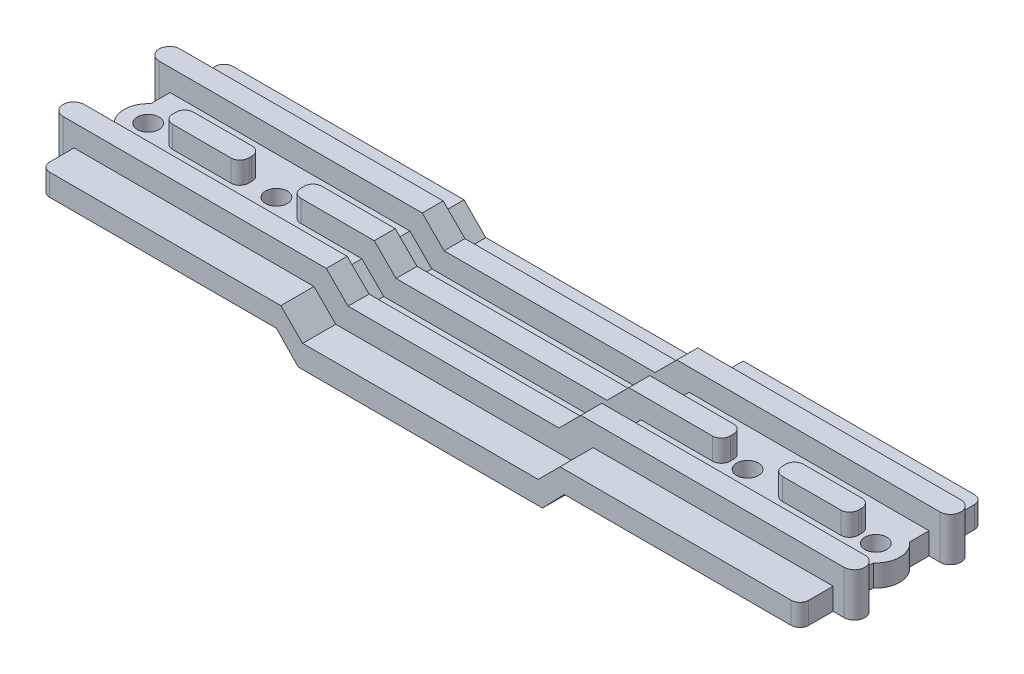
from build123d import *

# Parameters (mm, degrees)
BOSS_EXTRUDE1_DEPTH  = 10.5
SKETCH2_R            = 1.25
CUT_EXTRUDE1_DEPTH   = 46.038983115
BOSS_EXTRUDE19_DEPTH = 1.2
LPATTERN1_START      = -6.7
LPATTERN1_DEPTH      = 2.4
LPATTERN1_START_2    = 4.3
LPATTERN1_2_DEPTH    = 2.4
SKETCH5_R            = 3
CUT_EXTRUDE2_DEPTH   = 2.5
FILLET1_R            = 1
BOSS_EXTRUDE20_DEPTH = 5
FILLET2_R            = 1
BOSS_EXTRUDE21_DEPTH = 2.5


# Read off the part's stored shape, not the designer's step: LPattern1
with BuildPart() as part:
    # Sketch1 → Boss-Extrude1 (new, symmetric)
    with BuildSketch(Plane.XY):
        Polygon((-43.5, 2.6), (-16.5, 2.6), (-14, 0), (14, 0), (16.5, 2.6), (43.5, 2.6), (43.5, 5.1), (16, 5.1), (13.5, 2.6), (-13.5, 2.6), (-16, 5.1), (-43.5, 5.1), align=None)
    extrude(amount=BOSS_EXTRUDE1_DEPTH, both=True)

    # Sketch2 → Cut-Extrude1 (cut, through all)
    with BuildSketch(Plane(origin=(0, 5.1, 0), x_dir=(1, 0, 0), z_dir=(0, 1, 0))):
        with Locations(Location((27, 0, 0), (0, 0, 180))):
            Circle(SKETCH2_R)
        with Locations(Location((41.7, 0, 0), (0, 0, 180))):
            Circle(SKETCH2_R)
    cut_extrude1 = extrude(amount=-CUT_EXTRUDE1_DEPTH, mode=Mode.SUBTRACT)

    # Mirror1: Cut-Extrude1 across plane
    add(cut_extrude1.mirror(Plane(origin=(0, 0, 0), x_dir=(0, 0, 1), z_dir=(1, 0, 0))), mode=Mode.SUBTRACT)

    # Sketch4 → Boss-Extrude19 (add, symmetric)
    with BuildSketch(Plane.XY):
        Polygon((-43.5, 7.6), (-14.587766262, 7.6), (-12.087766262, 5.1), (12.087766262, 5.1), (14.587766262, 7.6), (43.5, 7.6), (43.5, 5.1), (16, 5.1), (13.5, 2.6), (-13.5, 2.6), (-16, 5.1), (-43.5, 5.1), align=None)
    boss_extrude19 = extrude(amount=BOSS_EXTRUDE19_DEPTH, both=True)

    # Mirror2: Boss-Extrude19 across plane
    add(boss_extrude19.mirror(Plane.XY))

    # LPattern1 outline → LPattern1 (add)
    with BuildSketch(Plane.XY.offset(LPATTERN1_START)):
        Polygon((14.587766262, 7.6), (12.087766262, 5.1), (-12.087766262, 5.1), (-14.587766262, 7.6), (-43.5, 7.6), (-43.5, 5.1), (-16, 5.1), (-13.5, 2.6), (13.5, 2.6), (16, 5.1), (43.5, 5.1), (43.5, 7.6), align=None)
    extrude(amount=LPATTERN1_DEPTH)

    # LPattern1 2 outline → LPattern1 2 (add)
    with BuildSketch(Plane.XY.offset(LPATTERN1_START_2)):
        Polygon((14.587766262, 7.6), (12.087766262, 5.1), (-12.087766262, 5.1), (-14.587766262, 7.6), (-43.5, 7.6), (-43.5, 5.1), (-16, 5.1), (-13.5, 2.6), (13.5, 2.6), (16, 5.1), (43.5, 5.1), (43.5, 7.6), align=None)
    extrude(amount=LPATTERN1_2_DEPTH)

    # Sketch5 → Cut-Extrude2 (cut)
    with BuildSketch(Plane(origin=(0, 7.6, 0), x_dir=(1, 0, 0), z_dir=(0, 1, 0))):
        with Locations((-41.7, 0)):
            Circle(SKETCH5_R)
        with Locations((-27, 0)):
            Circle(SKETCH5_R)
        with Locations((42.888677457, 0)):
            Circle(SKETCH5_R)
        with Locations((28.188677457, 0)):
            Circle(SKETCH5_R)
    extrude(amount=-CUT_EXTRUDE2_DEPTH, mode=Mode.SUBTRACT)

    # Fillet1
    fillet1_edges = [part.edges().sort_by_distance(p)[0] for p in [
        (-29.749545417, 6.35, -1.2),
        (-24.250454583, 6.35, -1.2),
        (40.13913204, 6.35, -1.2),
        (25.43913204, 6.35, -1.2),
        (30.938222874, 6.35, -1.2),
        (-38.950454583, 6.35, -1.2),
        (-38.950454583, 6.35, 1.2),
        (30.938222874, 6.35, 1.2),
        (25.43913204, 6.35, 1.2),
        (40.13913204, 6.35, 1.2),
        (-24.250454583, 6.35, 1.2),
        (-29.749545417, 6.35, 1.2),
    ]]
    fillet(fillet1_edges, radius=FILLET1_R)

    # Sketch6 → Boss-Extrude20 (add)
    with BuildSketch(Plane(origin=(0, 7.6, 0), x_dir=(1, 0, 0), z_dir=(0, 1, 0))):
        with BuildLine():
            Line((43.5, -4.3), (43.5, -6.7))
            Line((43.5, -6.7), (44.75, -6.7))
            ThreePointArc((44.75, -6.7), (45.95, -5.5), (44.75, -4.3))
            Line((44.75, -4.3), (43.5, -4.3))
        make_face()
        with BuildLine():
            Line((43.5, 6.7), (43.5, 4.3))
            Line((43.5, 4.3), (44.75, 4.3))
            ThreePointArc((44.75, 4.3), (45.95, 5.5), (44.75, 6.7))
            Line((44.75, 6.7), (43.5, 6.7))
        make_face()
        with BuildLine():
            Line((-43.5, 6.7), (-44.75, 6.7))
            ThreePointArc((-44.75, 6.7), (-45.95, 5.5), (-44.75, 4.3))
            Line((-44.75, 4.3), (-43.5, 4.3))
            Line((-43.5, 4.3), (-43.5, 6.7))
        make_face()
        with BuildLine():
            Line((-43.5, -4.3), (-44.75, -4.3))
            ThreePointArc((-44.75, -4.3), (-45.95, -5.5), (-44.75, -6.7))
            Line((-44.75, -6.7), (-43.5, -6.7))
            Line((-43.5, -6.7), (-43.5, -4.3))
        make_face()
    extrude(amount=-BOSS_EXTRUDE20_DEPTH)

    # Fillet2
    fillet2_edges = [part.edges().sort_by_distance(p)[0] for p in [
        (43.5, 3.85, 10.5),
        (-43.5, 3.85, 10.5),
        (43.5, 3.85, -10.5),
        (-43.5, 3.85, -10.5),
    ]]
    fillet(fillet2_edges, radius=FILLET2_R)

    # Sketch7 → Boss-Extrude21 (add)
    with BuildSketch(Plane(origin=(0, 5.1, 0), x_dir=(1, 0, 0), z_dir=(0, 1, 0))):
        with BuildLine():
            Line((43.5, -2.079062289), (43.5, 2.079062289))
            ThreePointArc((43.5, 2.079062289), (44.45, 0), (43.5, -2.079062289))
        make_face()
        with BuildLine():
            Line((-43.5, -2.079062289), (-43.5, 2.079062289))
            ThreePointArc((-43.5, 2.079062289), (-44.45, 0), (-43.5, -2.079062289))
        make_face()
    extrude(amount=-BOSS_EXTRUDE21_DEPTH)


solid = part.part
